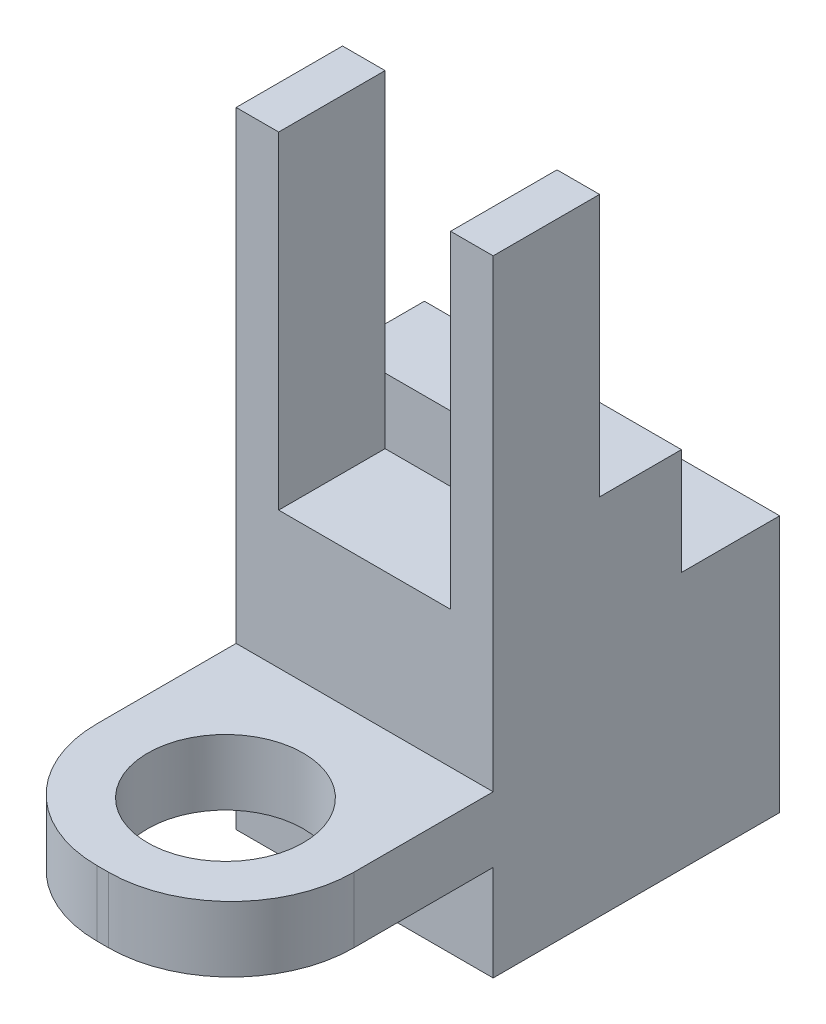
from build123d import *

# Parameters (mm, degrees)
SKETCH4_W            = 31.4
SKETCH4_H            = 31.4
SKETCH4_W_2          = 25.4
SKETCH4_H_2          = 25.4
BOSS_EXTRUDE3_DEPTH  = 30
SKETCH5_W            = 31.4
SKETCH5_H            = 31.4
BOSS_EXTRUDE4_DEPTH  = 5
SKETCH6_W            = 31.4
SKETCH6_H            = 8
BOSS_EXTRUDE5_DEPTH  = 5
BOSS_EXTRUDE6_DEPTH  = 8
SKETCH8_R            = 9.5
BOSS_EXTRUDE7_DEPTH  = 8
SKETCH9_W            = 31.4
SKETCH9_H            = 10
BOSS_EXTRUDE8_DEPTH  = 5
SKETCH10_W           = 31.4
SKETCH10_H           = 10
BOSS_EXTRUDE9_DEPTH  = 13
SKETCH11_W           = 5.2
SKETCH11_H           = 10
BOSS_EXTRUDE10_DEPTH = 40
BOSS_EXTRUDE11_DEPTH = 3
CUT_EXTRUDE1_START   = 8
SKETCH8_2_R          = 9.5
CUT_EXTRUDE1_DEPTH   = 24


with BuildPart() as part:
    # Sketch4 → Boss-Extrude3 (new body)
    with BuildSketch(Plane.XY):
        Rectangle(SKETCH4_W, SKETCH4_H)
        Rectangle(SKETCH4_W_2, SKETCH4_H_2, mode=Mode.SUBTRACT)
    extrude(amount=BOSS_EXTRUDE3_DEPTH)

    # Sketch5 → Boss-Extrude4 (add)
    with BuildSketch(Plane.XY.offset(30)):
        Rectangle(SKETCH5_W, SKETCH5_H)
    extrude(amount=BOSS_EXTRUDE4_DEPTH)

    # Sketch6 → Boss-Extrude5 (add)
    with BuildSketch(Plane.XY.offset(35)):
        Rectangle(SKETCH6_W, SKETCH6_H)
    extrude(amount=BOSS_EXTRUDE5_DEPTH)

    # Sketch7 → Boss-Extrude6 (add)
    with BuildSketch(Plane.XZ.offset(4)):
        with BuildLine():
            Line((-15.7, 40), (-15.7, 52))
            ThreePointArc((-15.7, 52), (-11.306601718, 62.606601718), (-0.7, 67))
            Line((-0.7, 67), (0.7, 67))
            ThreePointArc((0.7, 67), (11.306601718, 62.606601718), (15.7, 52))
            Line((15.7, 52), (15.7, 40))
            Line((15.7, 40), (-15.7, 40))
        make_face()
    extrude(amount=-BOSS_EXTRUDE6_DEPTH)

    # Sketch8 → Boss-Extrude7 (add)
    with BuildSketch(Plane.XZ.offset(4)):
        with Locations((0, 52)):
            Circle(SKETCH8_R)
    boss_extrude7 = extrude(amount=BOSS_EXTRUDE7_DEPTH)

    # Mirror1: Boss-Extrude7 across plane
    add(boss_extrude7.mirror(Plane.ZX))

    # Sketch9 → Boss-Extrude8 (add)
    with BuildSketch(Plane(origin=(0, 15.7, 0), x_dir=(1, 0, 0), z_dir=(0, 1, 0))):
        with Locations((0, -27)):
            Rectangle(SKETCH9_W, SKETCH9_H)
    extrude(amount=BOSS_EXTRUDE8_DEPTH)

    # Sketch10 → Boss-Extrude9 (add)
    with BuildSketch(Plane(origin=(0, 15.7, 0), x_dir=(1, 0, 0), z_dir=(0, 1, 0))):
        with Locations((0, -17)):
            Rectangle(SKETCH10_W, SKETCH10_H)
    extrude(amount=BOSS_EXTRUDE9_DEPTH)

    # Sketch11 → Boss-Extrude10 (add)
    with BuildSketch(Plane(origin=(0, 20.7, 0), x_dir=(1, 0, 0), z_dir=(0, 1, 0))):
        with Locations((-13.1, -27)):
            Rectangle(SKETCH11_W, SKETCH11_H)
        with Locations((13.1, -27)):
            Rectangle(SKETCH11_W, SKETCH11_H)
    extrude(amount=BOSS_EXTRUDE10_DEPTH)

    # Sketch12 → Boss-Extrude11 (add)
    with BuildSketch(Plane.XY.offset(32)):
        Polygon((-15.7, 60.7), (-10.5, 60.7), (-10.5, 20.7), (10.5, 20.7), (10.5, 60.7), (15.7, 60.7), (15.7, 15.7), (-15.7, 15.7), align=None)
    extrude(amount=BOSS_EXTRUDE11_DEPTH)

    # Sketch8<2> → Cut-Extrude1 (cut)
    with BuildSketch(Plane.XZ.offset(4).offset(CUT_EXTRUDE1_START)):
        with Locations((0, 52)):
            Circle(SKETCH8_2_R)
    extrude(amount=-CUT_EXTRUDE1_DEPTH, mode=Mode.SUBTRACT)


solid = part.part
